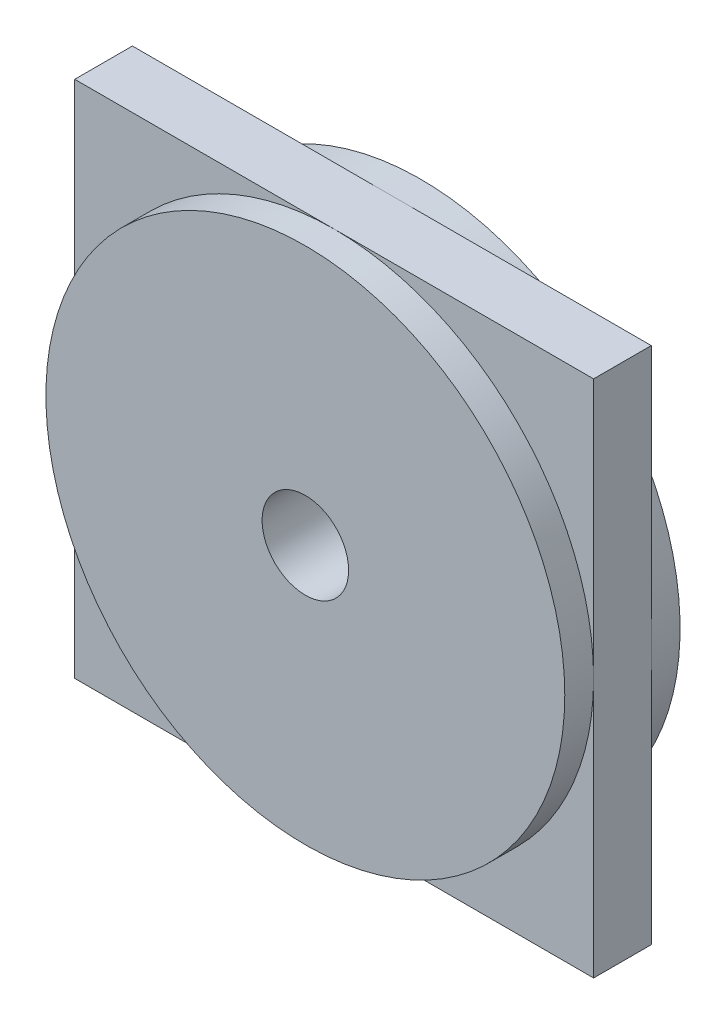
from build123d import *

# Parameters (mm, degrees)
SKETCH_1_W          = 18
SKETCH_1_H          = 18
EXTRUDE_1_DEPTH     = 2
SKETCH_2_R          = 9
EXTRUDE_2_DEPTH     = 1
EXTRUDE_START       = 1
SKETCH_3_R          = 9
EXTRUDE_3_DEPTH     = 1
SKETCH_4_R          = 1.5
CUT_EXTRUDE_1_DEPTH = 14.341664064


with BuildPart() as part:
    # Эскиз1 → Бобышка-Вытянуть1 (new body)
    with BuildSketch(Plane.XY):
        Rectangle(SKETCH_1_W, SKETCH_1_H)
    extrude(amount=EXTRUDE_1_DEPTH)

    # Эскиз2 → Бобышка-Вытянуть2 (add)
    with BuildSketch(Plane(origin=(0, 0, 0), x_dir=(-1, 0, 0), z_dir=(0, 0, -1))):
        Circle(SKETCH_2_R)
    extrude(amount=EXTRUDE_2_DEPTH)

    # Эскиз3 → Бобышка-Вытянуть3 (add)
    with BuildSketch(Plane.XY.offset(2).offset(EXTRUDE_START)):
        Circle(SKETCH_3_R)
    extrude(amount=-EXTRUDE_3_DEPTH)

    # Эскиз4 → Вырез-Вытянуть1 (cut, through all)
    with BuildSketch(Plane.XY.offset(3)):
        Circle(SKETCH_4_R)
    extrude(amount=-CUT_EXTRUDE_1_DEPTH, mode=Mode.SUBTRACT)


solid = part.part
